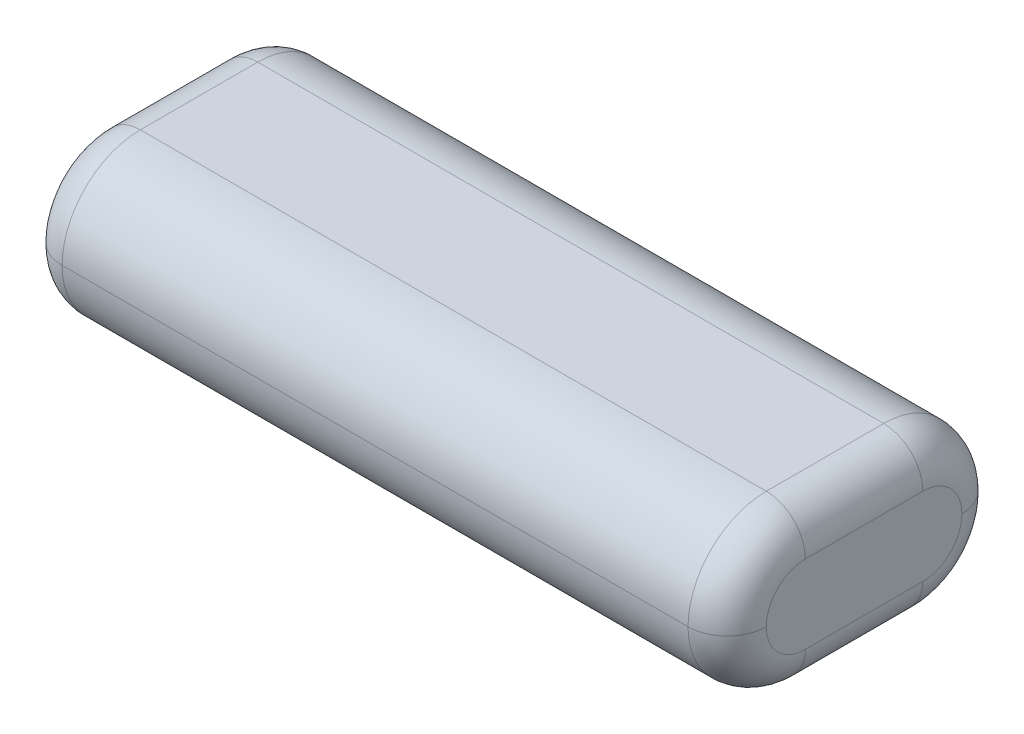
from build123d import *

# Parameters (mm, degrees)
SKETCH1_W           = 90
SKETCH1_H           = 35
BOSS_EXTRUDE1_DEPTH = 20
FILLET1_R           = 10
FILLET2_R           = 5


with BuildPart() as part:
    # Sketch1 → Boss-Extrude1 (new body)
    with BuildSketch(Plane(origin=(0, 0, 0), x_dir=(1, 0, 0), z_dir=(0, 1, 0))):
        with Locations((45, 17.5)):
            Rectangle(SKETCH1_W, SKETCH1_H)
    extrude(amount=BOSS_EXTRUDE1_DEPTH)

    # Fillet1
    fillet1_edges = [part.edges().sort_by_distance(p)[0] for p in [
        (45, 20, -35),
        (45, 0, -35),
        (45, 0, 0),
        (45, 20, 0),
    ]]
    fillet(fillet1_edges, radius=FILLET1_R - 0.0001)  # a hair under: the kernel refuses the full size

    # Fillet2
    fillet2_edges = [part.edges().sort_by_distance(p)[0] for p in [
        (0, 20, -17.5),
        (90, 20, -17.5),
        (0, 0, -17.5),
        (0, 17.071097101, -2.928902899),
        (0, 2.928902899, -2.928902899),
        (0, 2.928902899, -32.071097101),
        (0, 17.071097101, -32.071097101),
        (90, 0, -17.5),
        (90, 17.071097101, -2.928902899),
        (90, 2.928902899, -2.928902899),
        (90, 2.928902899, -32.071097101),
        (90, 17.071097101, -32.071097101),
    ]]
    fillet(fillet2_edges, radius=FILLET2_R)


solid = part.part
